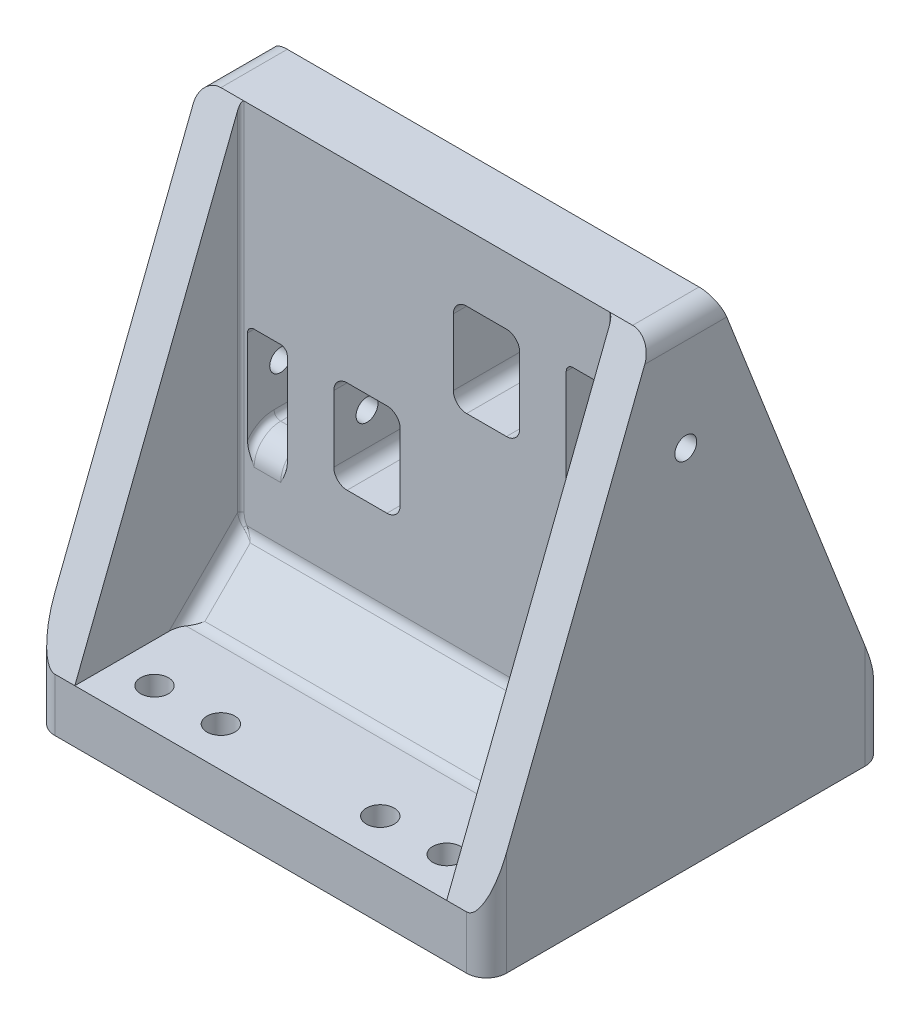
from build123d import *

# Parameters (mm, degrees)
SKETCH_1_W          = 68
SKETCH_1_H          = 60
EXTRUDE_1_DEPTH     = 8
SKETCH_2_W          = 68
SKETCH_2_H          = 64
SKETCH_2_W_2        = 6
SKETCH_2_H_2        = 14
EXTRUDE_2_DEPTH     = 5
SKETCH_5_W          = 10
SKETCH_5_H          = 14
CUT_EXTRUDE_3_DEPTH = 106.03808833
CUT_EXTRUDE_1_REACH = 117.793
SKETCH_3_R          = 1.65
CUT_EXTRUDE_2_REACH = 117.793
SKETCH_4_R          = 1.65
EXTRUDE_3_DEPTH     = 6
SKETCH_7_R          = 2.1
CUT_EXTRUDE_4_DEPTH = 111.995495404
FILLET_2_R          = 4
FILLET_1_R          = 1
FILLET_3_R          = 2
FILLET_4_R          = 3
CHAMFER_1_SIZE      = 8
FILLET_5_R          = 2
FILLET_6_R          = 3
FILLET_7_R          = 0.5


with BuildPart() as part:
    # 草图1 → 凸台-拉伸1 (new body)
    with BuildSketch(Plane(origin=(0, 0, 0), x_dir=(1, 0, 0), z_dir=(0, 1, 0))):
        with Locations((34, 30)):
            Rectangle(SKETCH_1_W, SKETCH_1_H)
    extrude(amount=EXTRUDE_1_DEPTH)

    # 草图2 → 凸台-拉伸2 (add, symmetric)
    with BuildSketch(Plane.XY.offset(-30)):
        with Locations((34, 40)):
            Rectangle(SKETCH_2_W, SKETCH_2_H)
        with Locations((10, 36)):
            Rectangle(SKETCH_2_W_2, SKETCH_2_H_2, mode=Mode.SUBTRACT)
        with Locations((58, 55)):
            Rectangle(SKETCH_2_W_2, SKETCH_2_H_2, mode=Mode.SUBTRACT)
    extrude(amount=EXTRUDE_2_DEPTH, both=True)

    # 草图5 → 切除-拉伸3 (cut, through all)
    with BuildSketch(Plane.XY.offset(-25)):
        with Locations((25, 36)):
            Rectangle(SKETCH_5_W, SKETCH_5_H)
        with Locations((43, 55)):
            Rectangle(SKETCH_5_W, SKETCH_5_H)
    extrude(amount=-CUT_EXTRUDE_3_DEPTH, mode=Mode.SUBTRACT)

    # 切除-拉伸1: up to this face of the body (flat: up to its plane)
    cut_extrude_1_end = Plane(part.part.faces().sort_by_distance((20, 36, -30))[0])
    # 草图3 → 切除-拉伸1 (cut, up to the picked face)
    with BuildSketch(Plane.ZY, mode=Mode.PRIVATE) as cut_extrude_1_sk1:
        with Locations((-30, 36)):
            Circle(SKETCH_3_R)
    cut_extrude_1_tool1 = split(extrude(cut_extrude_1_sk1.sketch, amount=-CUT_EXTRUDE_1_REACH, mode=Mode.PRIVATE), bisect_by=cut_extrude_1_end, keep=Keep.BOTH, mode=Mode.PRIVATE)
    add(cut_extrude_1_tool1.solids().sort_by(Axis((0, 36, -30), (1, 0, 0)))[0], mode=Mode.SUBTRACT)

    # 切除-拉伸2: up to this face of the body (flat: up to its plane)
    cut_extrude_2_end = Plane(part.part.faces().sort_by_distance((48, 55, -30))[0])
    # 草图4 → 切除-拉伸2 (cut, up to the picked face)
    with BuildSketch(Plane(origin=(68, 0, 0), x_dir=(0, 0, -1), z_dir=(1, 0, 0)), mode=Mode.PRIVATE) as cut_extrude_2_sk1:
        with Locations((30, 55)):
            Circle(SKETCH_4_R)
    cut_extrude_2_tool1 = split(extrude(cut_extrude_2_sk1.sketch, amount=-CUT_EXTRUDE_2_REACH, mode=Mode.PRIVATE), bisect_by=cut_extrude_2_end, keep=Keep.BOTH, mode=Mode.PRIVATE)
    add(cut_extrude_2_tool1.solids().sort_by(Axis((68, 55, -30), (-1, 0, 0)))[0], mode=Mode.SUBTRACT)

    # 草图6 → 凸台-拉伸3 (add)
    with BuildSketch(Plane.ZY):
        Polygon((-35, 72), (-60, 8), (-35, 8), align=None)
        Polygon((-25, 72), (-25, 8), (0, 8), align=None)
    extrude_3 = extrude(amount=-EXTRUDE_3_DEPTH)

    # 镜向1: 凸台-拉伸3 across plane
    add(extrude_3.mirror(Plane(origin=(34, 0, 0), x_dir=(0, 0, 1), z_dir=(1, 0, 0))))

    # 草图7 → 切除-拉伸4 (cut, through all)
    with BuildSketch(Plane(origin=(0, 8, 0), x_dir=(1, 0, 0), z_dir=(0, 1, 0))):
        with Locations(Location((12, 6, 0), (0, 0, 270))):
            Circle(SKETCH_7_R)
        with Locations(Location((56, 6, 0), (0, 0, 90))):
            Circle(SKETCH_7_R)
        with Locations(Location((56, 54, 0), (0, 0, 270))):
            Circle(SKETCH_7_R)
        with Locations(Location((12, 54, 0), (0, 0, 90))):
            Circle(SKETCH_7_R)
        with Locations(Location((22, 6, 0), (0, 0, 270))):
            Circle(SKETCH_7_R)
        with Locations(Location((46, 6, 0), (0, 0, 90))):
            Circle(SKETCH_7_R)
        with Locations(Location((46, 54, 0), (0, 0, 270))):
            Circle(SKETCH_7_R)
        with Locations(Location((22, 54, 0), (0, 0, 90))):
            Circle(SKETCH_7_R)
    extrude(amount=-CUT_EXTRUDE_4_DEPTH, mode=Mode.SUBTRACT)

    # 圆角2
    fillet_2_edges = [part.edges().sort_by_distance(p)[0] for p in [
        (10, 43, -35),
        (58, 62, -35),
        (10, 29, -25),
        (58, 48, -25),
    ]]
    fillet(fillet_2_edges, radius=FILLET_2_R)

    # 圆角1
    # the kernel refuses this fillet: 1 mm, written as the material it adds along each edge
    with BuildSketch(Plane(origin=(7, 29, -29), x_dir=(1, 0, 0), z_dir=(0, 0, -1)), Plane(origin=(55, 48, -29), x_dir=(1, 0, 0), z_dir=(0, 0, -1)), Plane(origin=(13, 43, -25), x_dir=(-1, 0, 0), z_dir=(0, 0, -1)), Plane(origin=(61, 62, -25), x_dir=(-1, 0, 0), z_dir=(0, 0, -1))) as fillet_1_piece_1:
        with BuildLine():
            CenterArc((FILLET_1_R, -FILLET_1_R), FILLET_1_R, 90, 90)
            Line((0, -FILLET_1_R), (0, 0))
            Line((0, 0), (FILLET_1_R, 0))
        make_face()
    extrude(amount=6)
    with BuildSketch(Plane(origin=(13, 29, -29), x_dir=(-1, 0, 0), z_dir=(0, 0, -1)), Plane(origin=(61, 48, -29), x_dir=(-1, 0, 0), z_dir=(0, 0, -1)), Plane(origin=(7, 43, -31), x_dir=(0, -1, 0), z_dir=(0, 0, 1)), Plane(origin=(55, 62, -31), x_dir=(0, -1, 0), z_dir=(0, 0, 1))) as fillet_1_piece_2:
        with BuildLine():
            CenterArc((FILLET_1_R, FILLET_1_R), FILLET_1_R, 180, 90)
            Line((0, FILLET_1_R), (0, 0))
            Line((0, 0), (FILLET_1_R, 0))
        make_face()
    extrude(amount=6)
    with BuildSketch(Plane(origin=(55, 66, -31), x_dir=(0, 0.5853008610590891, -0.8108161949810135), z_dir=(0, 0.8108161949810135, 0.5853008610590891))) as fillet_1_piece_3_section:
        with BuildLine():
            CenterArc((4 + FILLET_1_R, -FILLET_1_R), FILLET_1_R, 90, 90)
            Line((4 + FILLET_1_R, 0), (4, 0))
            Line((4, 0), (4, -FILLET_1_R))
        make_face()
    fillet_1_piece_3 = revolve(axis=Axis((55, 66, -31), (-1, 0, 0)), revolution_arc=125.824247309, mode=Mode.PRIVATE)
    fillet_1_piece_3 = split(fillet_1_piece_3, bisect_by=Plane(origin=(55.286110881, 62.969261803, -35), z_dir=(0, 0, 1)), keep=Keep.TOP, mode=Mode.PRIVATE)
    add(fillet_1_piece_3)
    with BuildSketch(Plane(origin=(61, 66, -31), x_dir=(0, 0.5853008610590891, -0.8108161949810135), z_dir=(0, 0.8108161949810135, 0.5853008610590891))) as fillet_1_piece_4_section:
        with BuildLine():
            CenterArc((4 + FILLET_1_R, FILLET_1_R), FILLET_1_R, 180, 90)
            Line((4 + FILLET_1_R, 0), (4, 0))
            Line((4, 0), (4, FILLET_1_R))
        make_face()
    fillet_1_piece_4 = revolve(axis=Axis((61, 66, -31), (-1, 0, 0)), revolution_arc=125.824247309, mode=Mode.PRIVATE)
    fillet_1_piece_4 = split(fillet_1_piece_4, bisect_by=Plane(origin=(60.713889114, 62.9692618, -35), z_dir=(0, 0, 1)), keep=Keep.TOP, mode=Mode.PRIVATE)
    add(fillet_1_piece_4)
    with BuildSketch(Plane(origin=(7, 47, -31), x_dir=(0, 0.5853008610590891, -0.8108161949810135), z_dir=(0, 0.8108161949810135, 0.5853008610590891))) as fillet_1_piece_5_section:
        with BuildLine():
            CenterArc((4 + FILLET_1_R, -FILLET_1_R), FILLET_1_R, 90, 90)
            Line((4 + FILLET_1_R, 0), (4, 0))
            Line((4, 0), (4, -FILLET_1_R))
        make_face()
    fillet_1_piece_5 = revolve(axis=Axis((7, 47, -31), (-1, 0, 0)), revolution_arc=125.824247309, mode=Mode.PRIVATE)
    fillet_1_piece_5 = split(fillet_1_piece_5, bisect_by=Plane(origin=(7.28610882, 43.969263388, -35), z_dir=(0, 0, 1)), keep=Keep.TOP, mode=Mode.PRIVATE)
    add(fillet_1_piece_5)
    with BuildSketch(Plane(origin=(13, 47, -31), x_dir=(0, 0.5853008610590891, -0.8108161949810135), z_dir=(0, 0.8108161949810135, 0.5853008610590891))) as fillet_1_piece_6_section:
        with BuildLine():
            CenterArc((4 + FILLET_1_R, FILLET_1_R), FILLET_1_R, 180, 90)
            Line((4 + FILLET_1_R, 0), (4, 0))
            Line((4, 0), (4, FILLET_1_R))
        make_face()
    fillet_1_piece_6 = revolve(axis=Axis((13, 47, -31), (-1, 0, 0)), revolution_arc=125.824247309, mode=Mode.PRIVATE)
    fillet_1_piece_6 = split(fillet_1_piece_6, bisect_by=Plane(origin=(12.71389118, 43.969263388, -35), z_dir=(0, 0, 1)), keep=Keep.TOP, mode=Mode.PRIVATE)
    add(fillet_1_piece_6)
    with BuildSketch(Plane(origin=(13, 25, -29), x_dir=(0, -0.5853008610590901, 0.8108161949810129), z_dir=(0, -0.8108161949810129, -0.5853008610590901))) as fillet_1_piece_7_section:
        with BuildLine():
            CenterArc((4 + FILLET_1_R, FILLET_1_R), FILLET_1_R, 180, 90)
            Line((4 + FILLET_1_R, 0), (4, 0))
            Line((4, 0), (4, FILLET_1_R))
        make_face()
    fillet_1_piece_7 = revolve(axis=Axis((13, 25, -29), (-1, 0, 0)), revolution_arc=125.824247309, mode=Mode.PRIVATE)
    fillet_1_piece_7 = split(fillet_1_piece_7, bisect_by=Plane(origin=(12.71389118, 28.030736611, -25), z_dir=(0, 0, -1)), keep=Keep.TOP, mode=Mode.PRIVATE)
    add(fillet_1_piece_7)
    with BuildSketch(Plane(origin=(7, 25, -29), x_dir=(0, -0.5853008610590891, 0.8108161949810135), z_dir=(0, -0.8108161949810135, -0.5853008610590891))) as fillet_1_piece_8_section:
        with BuildLine():
            CenterArc((4 + FILLET_1_R, -FILLET_1_R), FILLET_1_R, 90, 90)
            Line((4 + FILLET_1_R, 0), (4, 0))
            Line((4, 0), (4, -FILLET_1_R))
        make_face()
    fillet_1_piece_8 = revolve(axis=Axis((7, 25, -29), (-1, 0, 0)), revolution_arc=125.824247309, mode=Mode.PRIVATE)
    fillet_1_piece_8 = split(fillet_1_piece_8, bisect_by=Plane(origin=(7.286108821, 28.030736612, -25), z_dir=(0, 0, -1)), keep=Keep.TOP, mode=Mode.PRIVATE)
    add(fillet_1_piece_8)
    with BuildSketch(Plane(origin=(61, 44, -29), x_dir=(0, -0.5853008610590891, 0.8108161949810135), z_dir=(0, -0.8108161949810135, -0.5853008610590891))) as fillet_1_piece_9_section:
        with BuildLine():
            CenterArc((4 + FILLET_1_R, FILLET_1_R), FILLET_1_R, 180, 90)
            Line((4 + FILLET_1_R, 0), (4, 0))
            Line((4, 0), (4, FILLET_1_R))
        make_face()
    fillet_1_piece_9 = revolve(axis=Axis((61, 44, -29), (-1, 0, 0)), revolution_arc=125.824247309, mode=Mode.PRIVATE)
    fillet_1_piece_9 = split(fillet_1_piece_9, bisect_by=Plane(origin=(60.71389118, 47.030736611, -25), z_dir=(0, 0, -1)), keep=Keep.TOP, mode=Mode.PRIVATE)
    add(fillet_1_piece_9)
    with BuildSketch(Plane(origin=(55, 44, -29), x_dir=(0, -0.5853008610590891, 0.8108161949810135), z_dir=(0, -0.8108161949810135, -0.5853008610590891))) as fillet_1_piece_10_section:
        with BuildLine():
            CenterArc((4 + FILLET_1_R, -FILLET_1_R), FILLET_1_R, 90, 90)
            Line((4 + FILLET_1_R, 0), (4, 0))
            Line((4, 0), (4, -FILLET_1_R))
        make_face()
    fillet_1_piece_10 = revolve(axis=Axis((55, 44, -29), (-1, 0, 0)), revolution_arc=125.824247309, mode=Mode.PRIVATE)
    fillet_1_piece_10 = split(fillet_1_piece_10, bisect_by=Plane(origin=(55.28610882, 47.030736612, -25), z_dir=(0, 0, -1)), keep=Keep.TOP, mode=Mode.PRIVATE)
    add(fillet_1_piece_10)

    # 圆角3
    fillet_3_edges = [part.edges().sort_by_distance(p)[0] for p in [
        (30, 43, -30),
        (30, 29, -30),
        (20, 29, -30),
        (20, 43, -30),
        (38, 48, -30),
        (38, 62, -30),
        (48, 62, -30),
        (48, 48, -30),
    ]]
    fillet(fillet_3_edges, radius=FILLET_3_R)

    # 圆角4
    fillet_4_edges = [part.edges().sort_by_distance(p)[0] for p in [
        (0, 4, -60),
        (68, 4, -60),
        (68, 4, 0),
        (0, 4, 0),
    ]]
    fillet(fillet_4_edges, radius=FILLET_4_R)

    # 倒角1
    chamfer_1_edges = [part.edges().sort_by_distance(p)[0] for p in [
        (34, 8, -35),
        (34, 8, -25),
    ]]
    chamfer(chamfer_1_edges, length=CHAMFER_1_SIZE)

    # 圆角5
    fillet_5_edges = [part.edges().sort_by_distance(p)[0] for p in [
        (34, 8, -43),
        (62, 12, -39),
        (34, 16, -35),
        (6, 12, -39),
        (34, 16, -25),
        (62, 12, -21),
        (34, 8, -17),
        (6, 12, -21),
    ]]
    fillet(fillet_5_edges, radius=FILLET_5_R)

    # 圆角6
    fillet_6_edges = [part.edges().sort_by_distance(p)[0] for p in [
        (68, 72, -30),
        (0, 72, -30),
    ]]
    fillet(fillet_6_edges, radius=FILLET_6_R)

    # 圆角7
    fillet_7_edges = [part.edges().sort_by_distance(p)[0] for p in [
        (6, 45.414213562, -25),
        (62, 45.414213562, -25),
        (6.14158361, 17.783163023, -25),
        (61.85841639, 17.783163023, -25),
        (62, 45.414213562, -35),
        (6, 45.414213562, -35),
        (6.14158361, 17.783163023, -35),
        (61.85841639, 17.783163023, -35),
        (7.260886534, 16.036960474, -24.836730938),
        (60.739113466, 16.036960474, -24.836730938),
        (7.260886666, 16.036960344, -35.163269118),
        (60.73911301, 16.036960023, -35.163269256),
    ]]
    fillet(fillet_7_edges, radius=FILLET_7_R)


solid = part.part
